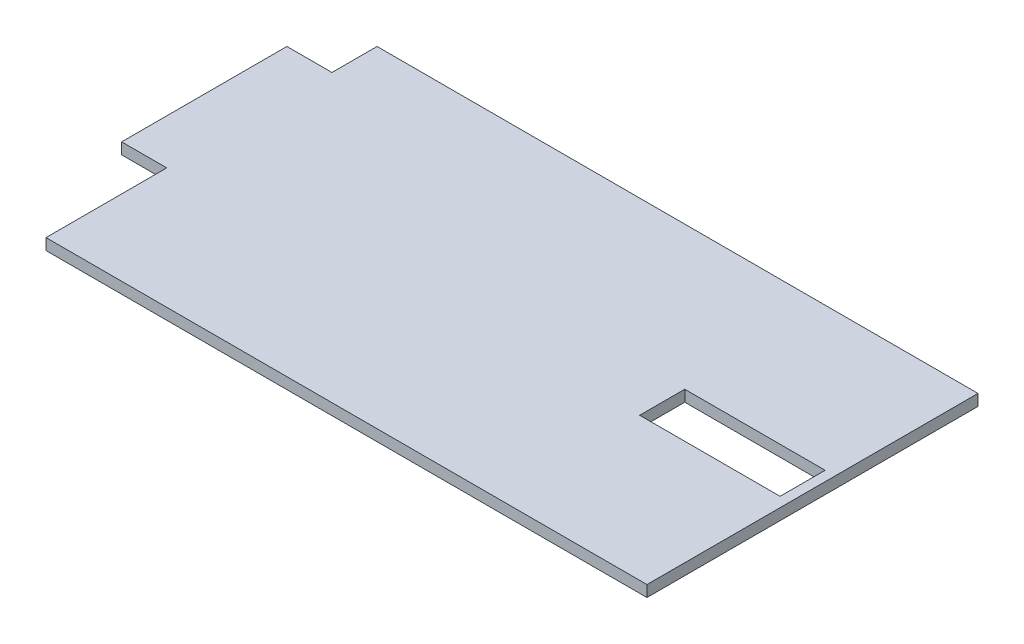
from build123d import *

# Parameters (mm, degrees)
SKETCH2_W           = 18.688991821
SKETCH2_H           = 6
BOSS_EXTRUDE1_DEPTH = 1.5


with BuildPart() as part:
    # Sketch2 → Boss-Extrude1 (new body)
    with BuildSketch(Plane(origin=(0, 0, 0), x_dir=(1, 0, 0), z_dir=(0, 1, 0))):
        Polygon((0, -6), (-6, -6), (-6, -28), (0, -28), (0, -44.07), (80, -44.07), (80, 0), (0, 0), align=None)
        with Locations((69.344495911, -22.035)):
            Rectangle(SKETCH2_W, SKETCH2_H, mode=Mode.SUBTRACT)
    extrude(amount=BOSS_EXTRUDE1_DEPTH)


solid = part.part
